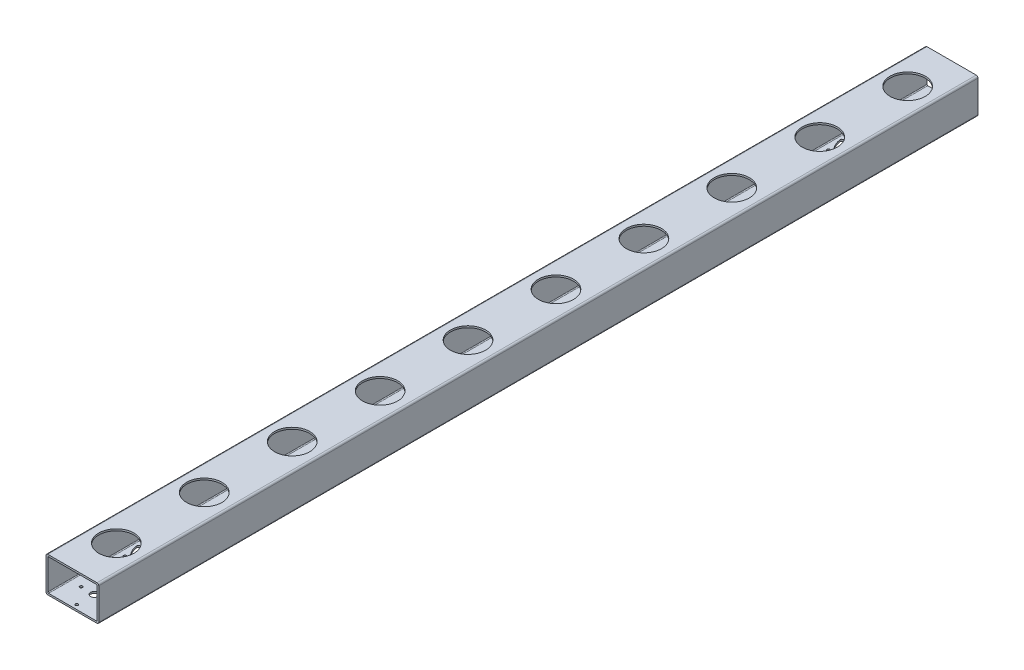
from build123d import *

# Parameters (mm, degrees)
ESQUISSE1_W                      = 60
ESQUISSE1_H                      = 40
ESQUISSE1_W_2                    = 56
ESQUISSE1_H_2                    = 36
BOSS_EXTRU_1_DEPTH               = 1000
CONG_1_R                         = 1
CONG_2_R                         = 2
ENL_V_MAT_EXTRU_1_REACH          = 1004.597
ESQUISSE2_R                      = 20
ENL_V_MAT_EXTRU_2_REACH          = 1004.597
ESQUISSE3_R                      = 4.25
ENL_V_MAT_EXTRU_4_REACH          = 1004.597
ESQUISSE6_R                      = 2.25
R_P_TITION_LIN_AIRE1_COUNT       = 3
R_P_TITION_LIN_AIRE1_PITCH       = 200
R_P_TITION_LIN_AIRE1_COUNT_DIR2  = 2
R_P_TITION_LIN_AIRE1_PITCH_DIR2  = 200
ENL_V_MAT_EXTRU_5_REACH          = 1004.597
ESQUISSE7_R                      = 1.6
ENL_V_MAT_EXTRU_6_REACH          = 1004.597
ESQUISSE9_R                      = 1.1
R_P_TITION_LIN_AIRE3_COUNT       = 10
R_P_TITION_LIN_AIRE3_PITCH       = 100
ENL_V_MAT_EXTRU_7_REACH          = 1004.597
ESQUISSE10_R                     = 1.75
R_P_TITION_LIN_AIRE4_COUNT       = 2
R_P_TITION_LIN_AIRE4_PITCH       = 800
ENL_V_MAT_EXTRU_8_REACH          = 1004.597
CONG_3_R                         = 2
R_P_TITION_LIN_AIRE5_COUNT       = 2
R_P_TITION_LIN_AIRE5_PITCH       = 800
CONG_3_OF_R_P_TITION_LIN_AIRE5_R = 2
ENL_V_MAT_EXTRU_9_REACH          = 1004.597
ESQUISSE12_R                     = 1.6
ENL_V_MAT_EXTRU_10_REACH         = 1004.597
ESQUISSE13_R                     = 1.9
ESQUISSE13_W                     = 26
ESQUISSE13_H                     = 14
ENL_V_MAT_EXTRU_11_REACH         = 1004.597
ESQUISSE14_R                     = 1.6
ENL_V_MAT_EXTRU_12_REACH         = 1004.597
ESQUISSE15_R                     = 2.5
ENL_V_MAT_EXTRU_13_REACH         = 1004.597
ESQUISSE16_R                     = 1.65
R_P_TITION_LIN_AIRE6_COUNT       = 10
R_P_TITION_LIN_AIRE6_PITCH       = 100


with BuildPart() as part:
    # Esquisse1 → Boss.-Extru.1 (new body)
    with BuildSketch(Plane.XY):
        with Locations((30, 20)):
            Rectangle(ESQUISSE1_W, ESQUISSE1_H)
        with Locations((30, 20)):
            Rectangle(ESQUISSE1_W_2, ESQUISSE1_H_2, mode=Mode.SUBTRACT)
    extrude(amount=BOSS_EXTRU_1_DEPTH)

    # Congé1
    cong_1_edges = [part.edges().sort_by_distance(p)[0] for p in [
        (58, 2, 500),
        (58, 38, 500),
        (2, 38, 500),
        (2, 2, 500),
    ]]
    fillet(cong_1_edges, radius=CONG_1_R)

    # Congé2
    cong_2_edges = [part.edges().sort_by_distance(p)[0] for p in [
        (60, 0, 500),
        (0, 0, 500),
        (60, 40, 500),
        (0, 40, 500),
    ]]
    fillet(cong_2_edges, radius=CONG_2_R)

    # Esquisse2 → Enlèv. mat.-Extru.1 (cut, up to next)
    with BuildSketch(Plane(origin=(0, 40, 0), x_dir=(1, 0, 0), z_dir=(0, 1, 0)), mode=Mode.PRIVATE) as enl_v_mat_extru_1_sk1:
        with Locations((30, -50)):
            Circle(ESQUISSE2_R)
    enl_v_mat_extru_1_tool1 = extrude(enl_v_mat_extru_1_sk1.sketch, amount=-ENL_V_MAT_EXTRU_1_REACH, mode=Mode.PRIVATE) & part.part
    # Esquisse2 → Enlèv. mat.-Extru.1 (cut, up to next)
    with BuildSketch(Plane(origin=(0, 40, 0), x_dir=(1, 0, 0), z_dir=(0, 1, 0)), mode=Mode.PRIVATE) as enl_v_mat_extru_1_sk2:
        with Locations((30, -150)):
            Circle(ESQUISSE2_R)
    enl_v_mat_extru_1_tool2 = extrude(enl_v_mat_extru_1_sk2.sketch, amount=-ENL_V_MAT_EXTRU_1_REACH, mode=Mode.PRIVATE) & part.part
    # Esquisse2 → Enlèv. mat.-Extru.1 (cut, up to next)
    with BuildSketch(Plane(origin=(0, 40, 0), x_dir=(1, 0, 0), z_dir=(0, 1, 0)), mode=Mode.PRIVATE) as enl_v_mat_extru_1_sk3:
        with Locations((30, -250)):
            Circle(ESQUISSE2_R)
    enl_v_mat_extru_1_tool3 = extrude(enl_v_mat_extru_1_sk3.sketch, amount=-ENL_V_MAT_EXTRU_1_REACH, mode=Mode.PRIVATE) & part.part
    # Esquisse2 → Enlèv. mat.-Extru.1 (cut, up to next)
    with BuildSketch(Plane(origin=(0, 40, 0), x_dir=(1, 0, 0), z_dir=(0, 1, 0)), mode=Mode.PRIVATE) as enl_v_mat_extru_1_sk4:
        with Locations((30, -350)):
            Circle(ESQUISSE2_R)
    enl_v_mat_extru_1_tool4 = extrude(enl_v_mat_extru_1_sk4.sketch, amount=-ENL_V_MAT_EXTRU_1_REACH, mode=Mode.PRIVATE) & part.part
    # Esquisse2 → Enlèv. mat.-Extru.1 (cut, up to next)
    with BuildSketch(Plane(origin=(0, 40, 0), x_dir=(1, 0, 0), z_dir=(0, 1, 0)), mode=Mode.PRIVATE) as enl_v_mat_extru_1_sk5:
        with Locations((30, -450)):
            Circle(ESQUISSE2_R)
    enl_v_mat_extru_1_tool5 = extrude(enl_v_mat_extru_1_sk5.sketch, amount=-ENL_V_MAT_EXTRU_1_REACH, mode=Mode.PRIVATE) & part.part
    # Esquisse2 → Enlèv. mat.-Extru.1 (cut, up to next)
    with BuildSketch(Plane(origin=(0, 40, 0), x_dir=(1, 0, 0), z_dir=(0, 1, 0)), mode=Mode.PRIVATE) as enl_v_mat_extru_1_sk6:
        with Locations((30, -550)):
            Circle(ESQUISSE2_R)
    enl_v_mat_extru_1_tool6 = extrude(enl_v_mat_extru_1_sk6.sketch, amount=-ENL_V_MAT_EXTRU_1_REACH, mode=Mode.PRIVATE) & part.part
    # Esquisse2 → Enlèv. mat.-Extru.1 (cut, up to next)
    with BuildSketch(Plane(origin=(0, 40, 0), x_dir=(1, 0, 0), z_dir=(0, 1, 0)), mode=Mode.PRIVATE) as enl_v_mat_extru_1_sk7:
        with Locations((30, -650)):
            Circle(ESQUISSE2_R)
    enl_v_mat_extru_1_tool7 = extrude(enl_v_mat_extru_1_sk7.sketch, amount=-ENL_V_MAT_EXTRU_1_REACH, mode=Mode.PRIVATE) & part.part
    # Esquisse2 → Enlèv. mat.-Extru.1 (cut, up to next)
    with BuildSketch(Plane(origin=(0, 40, 0), x_dir=(1, 0, 0), z_dir=(0, 1, 0)), mode=Mode.PRIVATE) as enl_v_mat_extru_1_sk8:
        with Locations((30, -750)):
            Circle(ESQUISSE2_R)
    enl_v_mat_extru_1_tool8 = extrude(enl_v_mat_extru_1_sk8.sketch, amount=-ENL_V_MAT_EXTRU_1_REACH, mode=Mode.PRIVATE) & part.part
    # Esquisse2 → Enlèv. mat.-Extru.1 (cut, up to next)
    with BuildSketch(Plane(origin=(0, 40, 0), x_dir=(1, 0, 0), z_dir=(0, 1, 0)), mode=Mode.PRIVATE) as enl_v_mat_extru_1_sk9:
        with Locations((30, -850)):
            Circle(ESQUISSE2_R)
    enl_v_mat_extru_1_tool9 = extrude(enl_v_mat_extru_1_sk9.sketch, amount=-ENL_V_MAT_EXTRU_1_REACH, mode=Mode.PRIVATE) & part.part
    # Esquisse2 → Enlèv. mat.-Extru.1 (cut, up to next)
    with BuildSketch(Plane(origin=(0, 40, 0), x_dir=(1, 0, 0), z_dir=(0, 1, 0)), mode=Mode.PRIVATE) as enl_v_mat_extru_1_sk10:
        with Locations((30, -950)):
            Circle(ESQUISSE2_R)
    enl_v_mat_extru_1_tool10 = extrude(enl_v_mat_extru_1_sk10.sketch, amount=-ENL_V_MAT_EXTRU_1_REACH, mode=Mode.PRIVATE) & part.part
    add(enl_v_mat_extru_1_tool1.solids().sort_by_distance((30, 40, 50))[0], mode=Mode.SUBTRACT)
    add(enl_v_mat_extru_1_tool2.solids().sort_by_distance((30, 40, 150))[0], mode=Mode.SUBTRACT)
    add(enl_v_mat_extru_1_tool3.solids().sort_by_distance((30, 40, 250))[0], mode=Mode.SUBTRACT)
    add(enl_v_mat_extru_1_tool4.solids().sort_by_distance((30, 40, 350))[0], mode=Mode.SUBTRACT)
    add(enl_v_mat_extru_1_tool5.solids().sort_by_distance((30, 40, 450))[0], mode=Mode.SUBTRACT)
    add(enl_v_mat_extru_1_tool6.solids().sort_by_distance((30, 40, 550))[0], mode=Mode.SUBTRACT)
    add(enl_v_mat_extru_1_tool7.solids().sort_by_distance((30, 40, 650))[0], mode=Mode.SUBTRACT)
    add(enl_v_mat_extru_1_tool8.solids().sort_by_distance((30, 40, 750))[0], mode=Mode.SUBTRACT)
    add(enl_v_mat_extru_1_tool9.solids().sort_by_distance((30, 40, 850))[0], mode=Mode.SUBTRACT)
    add(enl_v_mat_extru_1_tool10.solids().sort_by_distance((30, 40, 950))[0], mode=Mode.SUBTRACT)

    # Esquisse3 → Enlèv. mat.-Extru.2 (cut, up to next)
    with BuildSketch(Plane.XZ, mode=Mode.PRIVATE) as enl_v_mat_extru_2_sk1:
        with Locations((30, 975)):
            Circle(ESQUISSE3_R)
    enl_v_mat_extru_2_tool1 = extrude(enl_v_mat_extru_2_sk1.sketch, amount=-ENL_V_MAT_EXTRU_2_REACH, mode=Mode.PRIVATE) & part.part
    # Esquisse3 → Enlèv. mat.-Extru.2 (cut, up to next)
    with BuildSketch(Plane.XZ, mode=Mode.PRIVATE) as enl_v_mat_extru_2_sk2:
        with Locations((30, 25)):
            Circle(ESQUISSE3_R)
    enl_v_mat_extru_2_tool2 = extrude(enl_v_mat_extru_2_sk2.sketch, amount=-ENL_V_MAT_EXTRU_2_REACH, mode=Mode.PRIVATE) & part.part
    # Esquisse3 → Enlèv. mat.-Extru.2 (cut, up to next)
    with BuildSketch(Plane.XZ, mode=Mode.PRIVATE) as enl_v_mat_extru_2_sk3:
        with Locations((30, 500)):
            Circle(ESQUISSE3_R)
    enl_v_mat_extru_2_tool3 = extrude(enl_v_mat_extru_2_sk3.sketch, amount=-ENL_V_MAT_EXTRU_2_REACH, mode=Mode.PRIVATE) & part.part
    add(enl_v_mat_extru_2_tool1.solids().sort_by_distance((30, 0, 975))[0], mode=Mode.SUBTRACT)
    add(enl_v_mat_extru_2_tool2.solids().sort_by_distance((30, 0, 25))[0], mode=Mode.SUBTRACT)
    add(enl_v_mat_extru_2_tool3.solids().sort_by_distance((30, 0, 500))[0], mode=Mode.SUBTRACT)

    # Esquisse6 → Enlèv. mat.-Extru.4 (cut, up to next)
    with BuildSketch(Plane(origin=(0, 0, 0), x_dir=(-1, 0, 0), z_dir=(0, -1, 0)), mode=Mode.PRIVATE) as enl_v_mat_extru_4_sk1:
        with Locations((-20, -400)):
            Circle(ESQUISSE6_R)
    enl_v_mat_extru_4_tool1 = extrude(enl_v_mat_extru_4_sk1.sketch, amount=-ENL_V_MAT_EXTRU_4_REACH, mode=Mode.PRIVATE) & part.part
    # Esquisse6 → Enlèv. mat.-Extru.4 (cut, up to next)
    with BuildSketch(Plane(origin=(0, 0, 0), x_dir=(-1, 0, 0), z_dir=(0, -1, 0)), mode=Mode.PRIVATE) as enl_v_mat_extru_4_sk2:
        with Locations((-40, -400)):
            Circle(ESQUISSE6_R)
    enl_v_mat_extru_4_tool2 = extrude(enl_v_mat_extru_4_sk2.sketch, amount=-ENL_V_MAT_EXTRU_4_REACH, mode=Mode.PRIVATE) & part.part
    enl_v_mat_extru_4_1 = enl_v_mat_extru_4_tool1.solids().sort_by_distance((20, 0, 400))[0]
    add(enl_v_mat_extru_4_1, mode=Mode.SUBTRACT)
    enl_v_mat_extru_4_2 = enl_v_mat_extru_4_tool2.solids().sort_by_distance((40, 0, 400))[0]
    add(enl_v_mat_extru_4_2, mode=Mode.SUBTRACT)
    enl_v_mat_extru_4 = enl_v_mat_extru_4_1 + enl_v_mat_extru_4_2  # Enlèv. mat.-Extru.4 as one shape, for the pattern or mirror that repeats it

    # Répétition linéaire1: Enl_v. mat.-Extru.4 3 × 2
    with Locations(*[Vector(0, 0, 1) * (i * R_P_TITION_LIN_AIRE1_PITCH) + Vector(0, 0, -1) * (j * R_P_TITION_LIN_AIRE1_PITCH_DIR2) for i in range(R_P_TITION_LIN_AIRE1_COUNT) for j in range(R_P_TITION_LIN_AIRE1_COUNT_DIR2) if (i, j) != (0, 0)]):
        add(enl_v_mat_extru_4, mode=Mode.SUBTRACT)

    # Esquisse7 → Enlèv. mat.-Extru.5 (cut, up to next)
    with BuildSketch(Plane(origin=(0, 0, 0), x_dir=(-1, 0, 0), z_dir=(0, -1, 0)), mode=Mode.PRIVATE) as enl_v_mat_extru_5_sk1:
        with Locations((-15, -25)):
            Circle(ESQUISSE7_R)
    enl_v_mat_extru_5_tool1 = extrude(enl_v_mat_extru_5_sk1.sketch, amount=-ENL_V_MAT_EXTRU_5_REACH, mode=Mode.PRIVATE) & part.part
    # Esquisse7 → Enlèv. mat.-Extru.5 (cut, up to next)
    with BuildSketch(Plane(origin=(0, 0, 0), x_dir=(-1, 0, 0), z_dir=(0, -1, 0)), mode=Mode.PRIVATE) as enl_v_mat_extru_5_sk2:
        with Locations((-45, -25)):
            Circle(ESQUISSE7_R)
    enl_v_mat_extru_5_tool2 = extrude(enl_v_mat_extru_5_sk2.sketch, amount=-ENL_V_MAT_EXTRU_5_REACH, mode=Mode.PRIVATE) & part.part
    # Esquisse7 → Enlèv. mat.-Extru.5 (cut, up to next)
    with BuildSketch(Plane(origin=(0, 0, 0), x_dir=(-1, 0, 0), z_dir=(0, -1, 0)), mode=Mode.PRIVATE) as enl_v_mat_extru_5_sk3:
        with Locations((-15, -500)):
            Circle(ESQUISSE7_R)
    enl_v_mat_extru_5_tool3 = extrude(enl_v_mat_extru_5_sk3.sketch, amount=-ENL_V_MAT_EXTRU_5_REACH, mode=Mode.PRIVATE) & part.part
    # Esquisse7 → Enlèv. mat.-Extru.5 (cut, up to next)
    with BuildSketch(Plane(origin=(0, 0, 0), x_dir=(-1, 0, 0), z_dir=(0, -1, 0)), mode=Mode.PRIVATE) as enl_v_mat_extru_5_sk4:
        with Locations((-45, -500)):
            Circle(ESQUISSE7_R)
    enl_v_mat_extru_5_tool4 = extrude(enl_v_mat_extru_5_sk4.sketch, amount=-ENL_V_MAT_EXTRU_5_REACH, mode=Mode.PRIVATE) & part.part
    # Esquisse7 → Enlèv. mat.-Extru.5 (cut, up to next)
    with BuildSketch(Plane(origin=(0, 0, 0), x_dir=(-1, 0, 0), z_dir=(0, -1, 0)), mode=Mode.PRIVATE) as enl_v_mat_extru_5_sk5:
        with Locations((-15, -975)):
            Circle(ESQUISSE7_R)
    enl_v_mat_extru_5_tool5 = extrude(enl_v_mat_extru_5_sk5.sketch, amount=-ENL_V_MAT_EXTRU_5_REACH, mode=Mode.PRIVATE) & part.part
    # Esquisse7 → Enlèv. mat.-Extru.5 (cut, up to next)
    with BuildSketch(Plane(origin=(0, 0, 0), x_dir=(-1, 0, 0), z_dir=(0, -1, 0)), mode=Mode.PRIVATE) as enl_v_mat_extru_5_sk6:
        with Locations((-45, -975)):
            Circle(ESQUISSE7_R)
    enl_v_mat_extru_5_tool6 = extrude(enl_v_mat_extru_5_sk6.sketch, amount=-ENL_V_MAT_EXTRU_5_REACH, mode=Mode.PRIVATE) & part.part
    add(enl_v_mat_extru_5_tool1.solids().sort_by_distance((15, 0, 25))[0], mode=Mode.SUBTRACT)
    add(enl_v_mat_extru_5_tool2.solids().sort_by_distance((45, 0, 25))[0], mode=Mode.SUBTRACT)
    add(enl_v_mat_extru_5_tool3.solids().sort_by_distance((15, 0, 500))[0], mode=Mode.SUBTRACT)
    add(enl_v_mat_extru_5_tool4.solids().sort_by_distance((45, 0, 500))[0], mode=Mode.SUBTRACT)
    add(enl_v_mat_extru_5_tool5.solids().sort_by_distance((15, 0, 975))[0], mode=Mode.SUBTRACT)
    add(enl_v_mat_extru_5_tool6.solids().sort_by_distance((45, 0, 975))[0], mode=Mode.SUBTRACT)

    # Esquisse9 → Enlèv. mat.-Extru.6 (cut, up to next)
    with BuildSketch(Plane.XZ, mode=Mode.PRIVATE) as enl_v_mat_extru_6_sk1:
        with Locations((22, 955.18)):
            Circle(ESQUISSE9_R)
    enl_v_mat_extru_6_tool1 = extrude(enl_v_mat_extru_6_sk1.sketch, amount=-ENL_V_MAT_EXTRU_6_REACH, mode=Mode.PRIVATE) & part.part
    # Esquisse9 → Enlèv. mat.-Extru.6 (cut, up to next)
    with BuildSketch(Plane.XZ, mode=Mode.PRIVATE) as enl_v_mat_extru_6_sk2:
        with Locations((38, 955.18)):
            Circle(ESQUISSE9_R)
    enl_v_mat_extru_6_tool2 = extrude(enl_v_mat_extru_6_sk2.sketch, amount=-ENL_V_MAT_EXTRU_6_REACH, mode=Mode.PRIVATE) & part.part
    enl_v_mat_extru_6_1 = enl_v_mat_extru_6_tool1.solids().sort_by_distance((22, 0, 955.18))[0]
    add(enl_v_mat_extru_6_1, mode=Mode.SUBTRACT)
    enl_v_mat_extru_6_2 = enl_v_mat_extru_6_tool2.solids().sort_by_distance((38, 0, 955.18))[0]
    add(enl_v_mat_extru_6_2, mode=Mode.SUBTRACT)
    enl_v_mat_extru_6 = enl_v_mat_extru_6_1 + enl_v_mat_extru_6_2  # Enlèv. mat.-Extru.6 as one shape, for the pattern or mirror that repeats it

    # Répétition linéaire3: Enlèv. mat.-Extru.6 ×10
    with Locations(*[(0, 0, -i * R_P_TITION_LIN_AIRE3_PITCH) for i in range(1, R_P_TITION_LIN_AIRE3_COUNT)]):
        add(enl_v_mat_extru_6, mode=Mode.SUBTRACT)

    # Esquisse10 → Enlèv. mat.-Extru.7 (cut, up to next)
    with BuildSketch(Plane.XZ, mode=Mode.PRIVATE) as enl_v_mat_extru_7_sk1:
        with Locations((10, 120)):
            Circle(ESQUISSE10_R)
    enl_v_mat_extru_7_tool1 = extrude(enl_v_mat_extru_7_sk1.sketch, amount=-ENL_V_MAT_EXTRU_7_REACH, mode=Mode.PRIVATE) & part.part
    # Esquisse10 → Enlèv. mat.-Extru.7 (cut, up to next)
    with BuildSketch(Plane.XZ, mode=Mode.PRIVATE) as enl_v_mat_extru_7_sk2:
        with Locations((50, 120)):
            Circle(ESQUISSE10_R)
    enl_v_mat_extru_7_tool2 = extrude(enl_v_mat_extru_7_sk2.sketch, amount=-ENL_V_MAT_EXTRU_7_REACH, mode=Mode.PRIVATE) & part.part
    # Esquisse10 → Enlèv. mat.-Extru.7 (cut, up to next)
    with BuildSketch(Plane.XZ, mode=Mode.PRIVATE) as enl_v_mat_extru_7_sk3:
        with Locations((50, 80)):
            Circle(ESQUISSE10_R)
    enl_v_mat_extru_7_tool3 = extrude(enl_v_mat_extru_7_sk3.sketch, amount=-ENL_V_MAT_EXTRU_7_REACH, mode=Mode.PRIVATE) & part.part
    # Esquisse10 → Enlèv. mat.-Extru.7 (cut, up to next)
    with BuildSketch(Plane.XZ, mode=Mode.PRIVATE) as enl_v_mat_extru_7_sk4:
        with Locations((10, 80)):
            Circle(ESQUISSE10_R)
    enl_v_mat_extru_7_tool4 = extrude(enl_v_mat_extru_7_sk4.sketch, amount=-ENL_V_MAT_EXTRU_7_REACH, mode=Mode.PRIVATE) & part.part
    enl_v_mat_extru_7_1 = enl_v_mat_extru_7_tool1.solids().sort_by_distance((10, 0, 120))[0]
    add(enl_v_mat_extru_7_1, mode=Mode.SUBTRACT)
    enl_v_mat_extru_7_2 = enl_v_mat_extru_7_tool2.solids().sort_by_distance((50, 0, 120))[0]
    add(enl_v_mat_extru_7_2, mode=Mode.SUBTRACT)
    enl_v_mat_extru_7_3 = enl_v_mat_extru_7_tool3.solids().sort_by_distance((50, 0, 80))[0]
    add(enl_v_mat_extru_7_3, mode=Mode.SUBTRACT)
    enl_v_mat_extru_7_4 = enl_v_mat_extru_7_tool4.solids().sort_by_distance((10, 0, 80))[0]
    add(enl_v_mat_extru_7_4, mode=Mode.SUBTRACT)
    enl_v_mat_extru_7 = enl_v_mat_extru_7_1 + enl_v_mat_extru_7_2 + enl_v_mat_extru_7_3 + enl_v_mat_extru_7_4  # Enlèv. mat.-Extru.7 as one shape, for the pattern or mirror that repeats it

    # Répétition linéaire4: Enlèv. mat.-Extru.7 ×2
    with Locations(*[(0, 0, i * R_P_TITION_LIN_AIRE4_PITCH) for i in range(1, R_P_TITION_LIN_AIRE4_COUNT)]):
        add(enl_v_mat_extru_7, mode=Mode.SUBTRACT)

    # Esquisse11 → Enlèv. mat.-Extru.8 (cut, up to next)
    with BuildSketch(Plane.XZ, mode=Mode.PRIVATE) as enl_v_mat_extru_8_sk1:
        with BuildLine():
            ThreePointArc((38.120074974, 883.935617584), (21, 884.411542732), (12.027799244, 899))
            Line((12.027799244, 899), (6.020842383, 899))
            ThreePointArc((6.020842383, 899), (18, 879.215390309), (41.123553404, 878.733440343))
            Line((41.123553404, 878.733440343), (38.120074974, 883.935617584))
        make_face()
    enl_v_mat_extru_8_tool1 = extrude(enl_v_mat_extru_8_sk1.sketch, amount=-ENL_V_MAT_EXTRU_8_REACH, mode=Mode.PRIVATE) & part.part
    # Esquisse11 → Enlèv. mat.-Extru.8 (cut, up to next)
    with BuildSketch(Plane.XZ, mode=Mode.PRIVATE) as enl_v_mat_extru_8_sk2:
        with BuildLine():
            Line((39.852125782, 884.935617584), (42.855604212, 879.733440343))
            ThreePointArc((42.855604212, 879.733440343), (54, 900), (42.855604212, 920.266559657))
            Line((42.855604212, 920.266559657), (39.852125782, 915.064382416))
            ThreePointArc((39.852125782, 915.064382416), (48, 900), (39.852125782, 884.935617584))
        make_face()
    enl_v_mat_extru_8_tool2 = extrude(enl_v_mat_extru_8_sk2.sketch, amount=-ENL_V_MAT_EXTRU_8_REACH, mode=Mode.PRIVATE) & part.part
    # Esquisse11 → Enlèv. mat.-Extru.8 (cut, up to next)
    with BuildSketch(Plane.XZ, mode=Mode.PRIVATE) as enl_v_mat_extru_8_sk3:
        with BuildLine():
            ThreePointArc((41.123553404, 921.266559657), (18, 920.784609691), (6.020842383, 901))
            Line((6.020842383, 901), (12.027799244, 901))
            ThreePointArc((12.027799244, 901), (21, 915.588457268), (38.120074974, 916.064382416))
            Line((38.120074974, 916.064382416), (41.123553404, 921.266559657))
        make_face()
    enl_v_mat_extru_8_tool3 = extrude(enl_v_mat_extru_8_sk3.sketch, amount=-ENL_V_MAT_EXTRU_8_REACH, mode=Mode.PRIVATE) & part.part
    # Esquisse11 → Enlèv. mat.-Extru.8 (cut, up to next)
    with BuildSketch(Plane.XZ, mode=Mode.PRIVATE) as enl_v_mat_extru_8_sk4:
        with BuildLine():
            ThreePointArc((34.108911782, 890.88315603), (25, 891.339745962), (20.050125629, 899))
            Line((20.050125629, 899), (14.031280577, 899))
            ThreePointArc((14.031280577, 899), (22, 886.143593539), (37.118334308, 885.670683314))
            Line((37.118334308, 885.670683314), (34.108911782, 890.88315603))
        make_face()
    enl_v_mat_extru_8_tool4 = extrude(enl_v_mat_extru_8_sk4.sketch, amount=-ENL_V_MAT_EXTRU_8_REACH, mode=Mode.PRIVATE) & part.part
    # Esquisse11 → Enlèv. mat.-Extru.8 (cut, up to next)
    with BuildSketch(Plane.XZ, mode=Mode.PRIVATE) as enl_v_mat_extru_8_sk5:
        with BuildLine():
            Line((14.031280577, 901), (20.050125629, 901))
            ThreePointArc((20.050125629, 901), (25, 908.660254038), (34.108911782, 909.11684397))
            Line((34.108911782, 909.11684397), (37.118334308, 914.329316686))
            ThreePointArc((37.118334308, 914.329316686), (22, 913.856406461), (14.031280577, 901))
        make_face()
    enl_v_mat_extru_8_tool5 = extrude(enl_v_mat_extru_8_sk5.sketch, amount=-ENL_V_MAT_EXTRU_8_REACH, mode=Mode.PRIVATE) & part.part
    # Esquisse11 → Enlèv. mat.-Extru.8 (cut, up to next)
    with BuildSketch(Plane.XZ, mode=Mode.PRIVATE) as enl_v_mat_extru_8_sk6:
        with BuildLine():
            Line((38.850385115, 913.329316686), (35.840962589, 908.11684397))
            ThreePointArc((35.840962589, 908.11684397), (40, 900), (35.840962589, 891.88315603))
            Line((35.840962589, 891.88315603), (38.850385115, 886.670683314))
            ThreePointArc((38.850385115, 886.670683314), (46, 900), (38.850385115, 913.329316686))
        make_face()
    enl_v_mat_extru_8_tool6 = extrude(enl_v_mat_extru_8_sk6.sketch, amount=-ENL_V_MAT_EXTRU_8_REACH, mode=Mode.PRIVATE) & part.part
    enl_v_mat_extru_8_1 = enl_v_mat_extru_8_tool1.solids().sort_by_distance((39.258372, 0, 881.124696))[0]
    add(enl_v_mat_extru_8_1, mode=Mode.SUBTRACT)
    enl_v_mat_extru_8_2 = enl_v_mat_extru_8_tool2.solids().sort_by_distance((53.570687, 0, 900))[0]
    add(enl_v_mat_extru_8_2, mode=Mode.SUBTRACT)
    enl_v_mat_extru_8_3 = enl_v_mat_extru_8_tool3.solids().sort_by_distance((20.790167, 0, 915.951899))[0]
    add(enl_v_mat_extru_8_3, mode=Mode.SUBTRACT)
    enl_v_mat_extru_8_4 = enl_v_mat_extru_8_tool4.solids().sort_by_distance((24.369775, 0, 890.248165))[0]
    add(enl_v_mat_extru_8_4, mode=Mode.SUBTRACT)
    enl_v_mat_extru_8_5 = enl_v_mat_extru_8_tool5.solids().sort_by_distance((24.369775, 0, 909.751835))[0]
    add(enl_v_mat_extru_8_5, mode=Mode.SUBTRACT)
    enl_v_mat_extru_8_6 = enl_v_mat_extru_8_tool6.solids().sort_by_distance((41.260449, 0, 900))[0]
    add(enl_v_mat_extru_8_6, mode=Mode.SUBTRACT)
    enl_v_mat_extru_8 = enl_v_mat_extru_8_1 + enl_v_mat_extru_8_2 + enl_v_mat_extru_8_3 + enl_v_mat_extru_8_4 + enl_v_mat_extru_8_5 + enl_v_mat_extru_8_6  # Enlèv. mat.-Extru.8 as one shape, for the pattern or mirror that repeats it

    # Congé3
    cong_3_edges = [part.edges().sort_by_distance(p)[0] for p in [
        (6.020842383, 1, 899),
        (12.027799244, 1, 899),
        (14.031280577, 1, 899),
        (20.050125629, 1, 899),
        (34.108911782, 1, 890.88315603),
        (37.118334308, 1, 885.670683314),
        (38.120074974, 1, 883.935617584),
        (41.123553404, 1, 878.733440343),
        (42.855604212, 1, 879.733440343),
        (38.850385115, 1, 886.670683314),
        (39.852125782, 1, 884.935617584),
        (35.840962589, 1, 891.88315603),
        (39.852125782, 1, 915.064382416),
        (42.855604212, 1, 920.266559657),
        (35.840962589, 1, 908.11684397),
        (38.850385115, 1, 913.329316686),
        (34.108911782, 1, 909.11684397),
        (37.118334308, 1, 914.329316686),
        (20.050125629, 1, 901),
        (14.031280577, 1, 901),
        (6.020842383, 1, 901),
        (12.027799244, 1, 901),
        (38.120074974, 1, 916.064382416),
        (41.123553404, 1, 921.266559657),
    ]]
    fillet(cong_3_edges, radius=CONG_3_R)

    # Répétition linéaire5: Enlèv. mat.-Extru.8 ×2
    with Locations(*[(0, 0, -i * R_P_TITION_LIN_AIRE5_PITCH) for i in range(1, R_P_TITION_LIN_AIRE5_COUNT)]):
        add(enl_v_mat_extru_8, mode=Mode.SUBTRACT)

    # Congé3 of Répétition linéaire5
    cong_3_of_r_p_tition_lin_aire5_edges = [part.edges().sort_by_distance(p)[0] for p in [
        (6.020842383, 1, 99),
        (12.027799244, 1, 99),
        (14.031280577, 1, 99),
        (20.050125629, 1, 99),
        (34.108911782, 1, 90.88315603),
        (37.118334308, 1, 85.670683314),
        (38.120074974, 1, 83.935617584),
        (41.123553404, 1, 78.733440343),
        (42.855604212, 1, 79.733440343),
        (38.850385115, 1, 86.670683314),
        (39.852125782, 1, 84.935617584),
        (35.840962589, 1, 91.88315603),
        (39.852125782, 1, 115.064382416),
        (42.855604212, 1, 120.266559657),
        (35.840962589, 1, 108.11684397),
        (38.850385115, 1, 113.329316686),
        (34.108911782, 1, 109.11684397),
        (37.118334308, 1, 114.329316686),
        (20.050125629, 1, 101),
        (14.031280577, 1, 101),
        (6.020842383, 1, 101),
        (12.027799244, 1, 101),
        (38.120074974, 1, 116.064382416),
        (41.123553404, 1, 121.266559657),
    ]]
    fillet(cong_3_of_r_p_tition_lin_aire5_edges, radius=CONG_3_OF_R_P_TITION_LIN_AIRE5_R)

    # Esquisse12 → Enlèv. mat.-Extru.9 (cut, up to next)
    with BuildSketch(Plane.XZ, mode=Mode.PRIVATE) as enl_v_mat_extru_9_sk1:
        with Locations((10, 740.18)):
            Circle(ESQUISSE12_R)
    enl_v_mat_extru_9_tool1 = extrude(enl_v_mat_extru_9_sk1.sketch, amount=-ENL_V_MAT_EXTRU_9_REACH, mode=Mode.PRIVATE) & part.part
    # Esquisse12 → Enlèv. mat.-Extru.9 (cut, up to next)
    with BuildSketch(Plane.XZ, mode=Mode.PRIVATE) as enl_v_mat_extru_9_sk2:
        with Locations((50, 740.18)):
            Circle(ESQUISSE12_R)
    enl_v_mat_extru_9_tool2 = extrude(enl_v_mat_extru_9_sk2.sketch, amount=-ENL_V_MAT_EXTRU_9_REACH, mode=Mode.PRIVATE) & part.part
    # Esquisse12 → Enlèv. mat.-Extru.9 (cut, up to next)
    with BuildSketch(Plane.XZ, mode=Mode.PRIVATE) as enl_v_mat_extru_9_sk3:
        with Locations((50, 670.18)):
            Circle(ESQUISSE12_R)
    enl_v_mat_extru_9_tool3 = extrude(enl_v_mat_extru_9_sk3.sketch, amount=-ENL_V_MAT_EXTRU_9_REACH, mode=Mode.PRIVATE) & part.part
    # Esquisse12 → Enlèv. mat.-Extru.9 (cut, up to next)
    with BuildSketch(Plane.XZ, mode=Mode.PRIVATE) as enl_v_mat_extru_9_sk4:
        with Locations((10, 670.18)):
            Circle(ESQUISSE12_R)
    enl_v_mat_extru_9_tool4 = extrude(enl_v_mat_extru_9_sk4.sketch, amount=-ENL_V_MAT_EXTRU_9_REACH, mode=Mode.PRIVATE) & part.part
    add(enl_v_mat_extru_9_tool1.solids().sort_by_distance((10, 0, 740.18))[0], mode=Mode.SUBTRACT)
    add(enl_v_mat_extru_9_tool2.solids().sort_by_distance((50, 0, 740.18))[0], mode=Mode.SUBTRACT)
    add(enl_v_mat_extru_9_tool3.solids().sort_by_distance((50, 0, 670.18))[0], mode=Mode.SUBTRACT)
    add(enl_v_mat_extru_9_tool4.solids().sort_by_distance((10, 0, 670.18))[0], mode=Mode.SUBTRACT)

    # Esquisse13 → Enlèv. mat.-Extru.10 (cut, up to next)
    with BuildSketch(Plane.XZ, mode=Mode.PRIVATE) as enl_v_mat_extru_10_sk1:
        with Locations((17, 705.18)):
            Circle(ESQUISSE13_R)
    enl_v_mat_extru_10_tool1 = extrude(enl_v_mat_extru_10_sk1.sketch, amount=-ENL_V_MAT_EXTRU_10_REACH, mode=Mode.PRIVATE) & part.part
    # Esquisse13 → Enlèv. mat.-Extru.10 (cut, up to next)
    with BuildSketch(Plane.XZ, mode=Mode.PRIVATE) as enl_v_mat_extru_10_sk2:
        with Locations((30, 705.18)):
            Circle(ESQUISSE13_R)
    enl_v_mat_extru_10_tool2 = extrude(enl_v_mat_extru_10_sk2.sketch, amount=-ENL_V_MAT_EXTRU_10_REACH, mode=Mode.PRIVATE) & part.part
    # Esquisse13 → Enlèv. mat.-Extru.10 (cut, up to next)
    with BuildSketch(Plane.XZ, mode=Mode.PRIVATE) as enl_v_mat_extru_10_sk3:
        with Locations((43, 705.18)):
            Circle(ESQUISSE13_R)
    enl_v_mat_extru_10_tool3 = extrude(enl_v_mat_extru_10_sk3.sketch, amount=-ENL_V_MAT_EXTRU_10_REACH, mode=Mode.PRIVATE) & part.part
    # Esquisse13 → Enlèv. mat.-Extru.10 (cut, up to next)
    with BuildSketch(Plane.XZ, mode=Mode.PRIVATE) as enl_v_mat_extru_10_sk4:
        with Locations((30, 722.18)):
            Rectangle(ESQUISSE13_W, ESQUISSE13_H)
    enl_v_mat_extru_10_tool4 = extrude(enl_v_mat_extru_10_sk4.sketch, amount=-ENL_V_MAT_EXTRU_10_REACH, mode=Mode.PRIVATE) & part.part
    add(enl_v_mat_extru_10_tool1.solids().sort_by_distance((17, 0, 705.18))[0], mode=Mode.SUBTRACT)
    add(enl_v_mat_extru_10_tool2.solids().sort_by_distance((30, 0, 705.18))[0], mode=Mode.SUBTRACT)
    add(enl_v_mat_extru_10_tool3.solids().sort_by_distance((43, 0, 705.18))[0], mode=Mode.SUBTRACT)
    add(enl_v_mat_extru_10_tool4.solids().sort_by_distance((30, 0, 722.18))[0], mode=Mode.SUBTRACT)

    # Esquisse14 → Enlèv. mat.-Extru.11 (cut, up to next)
    with BuildSketch(Plane.XZ, mode=Mode.PRIVATE) as enl_v_mat_extru_11_sk1:
        with Locations((30, 5)):
            Circle(ESQUISSE14_R)
    enl_v_mat_extru_11_tool1 = extrude(enl_v_mat_extru_11_sk1.sketch, amount=-ENL_V_MAT_EXTRU_11_REACH, mode=Mode.PRIVATE) & part.part
    # Esquisse14 → Enlèv. mat.-Extru.11 (cut, up to next)
    with BuildSketch(Plane.XZ, mode=Mode.PRIVATE) as enl_v_mat_extru_11_sk2:
        with Locations((30, 995)):
            Circle(ESQUISSE14_R)
    enl_v_mat_extru_11_tool2 = extrude(enl_v_mat_extru_11_sk2.sketch, amount=-ENL_V_MAT_EXTRU_11_REACH, mode=Mode.PRIVATE) & part.part
    add(enl_v_mat_extru_11_tool1.solids().sort_by_distance((30, 0, 5))[0], mode=Mode.SUBTRACT)
    add(enl_v_mat_extru_11_tool2.solids().sort_by_distance((30, 0, 995))[0], mode=Mode.SUBTRACT)

    # Esquisse15 → Enlèv. mat.-Extru.12 (cut, up to next)
    with BuildSketch(Plane.XZ, mode=Mode.PRIVATE) as enl_v_mat_extru_12_sk1:
        with Locations((30, 425)):
            Circle(ESQUISSE15_R)
    enl_v_mat_extru_12_tool1 = extrude(enl_v_mat_extru_12_sk1.sketch, amount=-ENL_V_MAT_EXTRU_12_REACH, mode=Mode.PRIVATE) & part.part
    add(enl_v_mat_extru_12_tool1.solids().sort_by_distance((30, 0, 425))[0], mode=Mode.SUBTRACT)

    # Esquisse16 → Enlèv. mat.-Extru.13 (cut, up to next)
    with BuildSketch(Plane.XZ, mode=Mode.PRIVATE) as enl_v_mat_extru_13_sk1:
        with Locations((30, 962.7)):
            Circle(ESQUISSE16_R)
    enl_v_mat_extru_13_tool1 = extrude(enl_v_mat_extru_13_sk1.sketch, amount=-ENL_V_MAT_EXTRU_13_REACH, mode=Mode.PRIVATE) & part.part
    # Esquisse16 → Enlèv. mat.-Extru.13 (cut, up to next)
    with BuildSketch(Plane.XZ, mode=Mode.PRIVATE) as enl_v_mat_extru_13_sk2:
        with Locations((30, 937.3)):
            Circle(ESQUISSE16_R)
    enl_v_mat_extru_13_tool2 = extrude(enl_v_mat_extru_13_sk2.sketch, amount=-ENL_V_MAT_EXTRU_13_REACH, mode=Mode.PRIVATE) & part.part
    enl_v_mat_extru_13_1 = enl_v_mat_extru_13_tool1.solids().sort_by_distance((30, 0, 962.7))[0]
    add(enl_v_mat_extru_13_1, mode=Mode.SUBTRACT)
    enl_v_mat_extru_13_2 = enl_v_mat_extru_13_tool2.solids().sort_by_distance((30, 0, 937.3))[0]
    add(enl_v_mat_extru_13_2, mode=Mode.SUBTRACT)
    enl_v_mat_extru_13 = enl_v_mat_extru_13_1 + enl_v_mat_extru_13_2  # Enlèv. mat.-Extru.13 as one shape, for the pattern or mirror that repeats it

    # Répétition linéaire6: Enlèv. mat.-Extru.13 ×10
    with Locations(*[(0, 0, -i * R_P_TITION_LIN_AIRE6_PITCH) for i in range(1, R_P_TITION_LIN_AIRE6_COUNT)]):
        add(enl_v_mat_extru_13, mode=Mode.SUBTRACT)


solid = part.part
